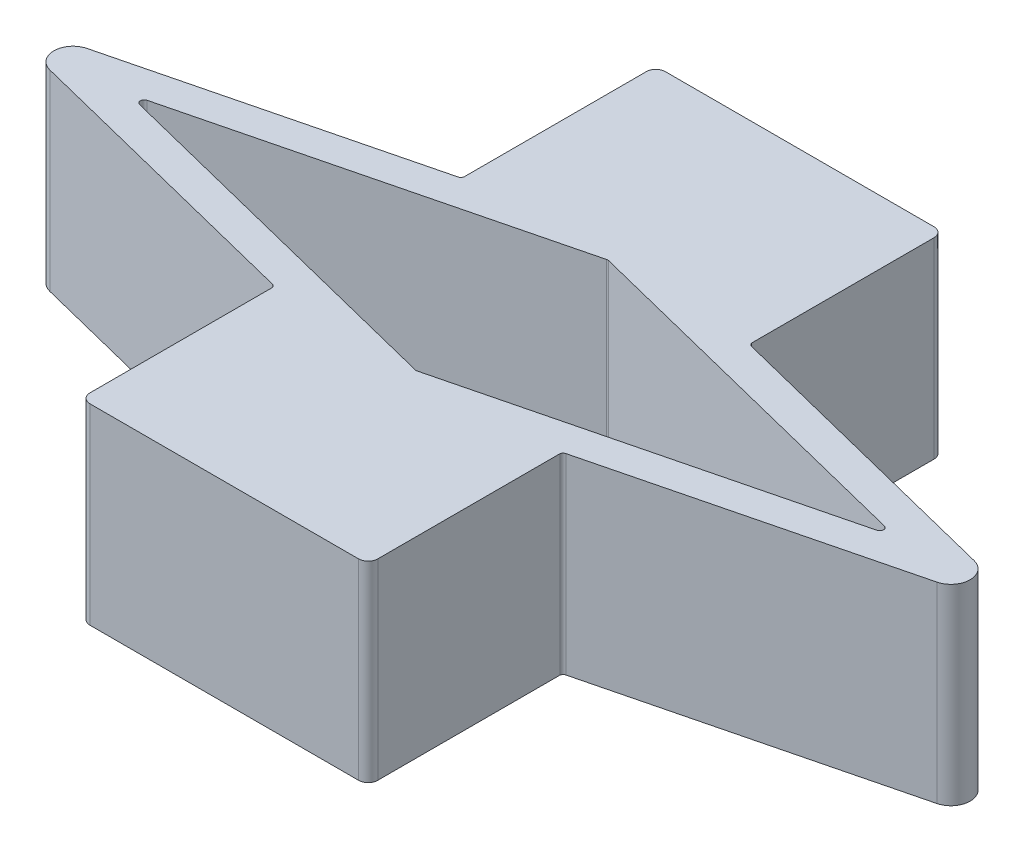
from build123d import *

# Parameters (mm, degrees)
SKETCH1_W             = 15
SKETCH1_H             = 10
BOSS_EXTRUDE2_DEPTH   = 10
BOSS_EXTRUDE2_2_DEPTH = 10
BOSS_EXTRUDE3_DEPTH   = 10
FILLET1_R             = 0.2
FILLET2_R             = 1
FILLET3_R             = 0.5


with BuildPart() as part:
    # Sketch1 → Boss-Extrude2 (new body)
    with BuildSketch(Plane(origin=(0, 0, 0), x_dir=(1, 0, 0), z_dir=(0, 1, 0))):
        with Locations((0, 20)):
            Rectangle(SKETCH1_W, SKETCH1_H)
    extrude(amount=BOSS_EXTRUDE2_DEPTH)



with BuildPart() as body_2:
    # Sketch1 → Boss-Extrude2 2 (new body)
    with BuildSketch(Plane(origin=(0, 0, 0), x_dir=(1, 0, 0), z_dir=(0, 1, 0))):
        Rectangle(SKETCH1_W, SKETCH1_H)
    extrude(amount=BOSS_EXTRUDE2_2_DEPTH)


with BuildPart() as part_1:
    add(part.part)

    add(body_2.part)  # Boss-Extrude3 merges body 2
    # Sketch1<4> → Boss-Extrude3 (add)
    with BuildSketch(Plane(origin=(0, 0, 0), x_dir=(1, 0, 0), z_dir=(0, 1, 0))):
        Polygon((-20, 10), (0, 15), (-7.009279564, 15), (-27.009279564, 10), (-7.009279564, 5), (0, 5), align=None)
    boss_extrude3 = extrude(amount=BOSS_EXTRUDE3_DEPTH)

    # Mirror1: Boss-Extrude3 across plane
    add(boss_extrude3.mirror(Plane.ZY))

    # Fillet1
    # the kernel refuses this fillet: 0.2 mm, written as the material it adds along each edge
    with BuildSketch(Plane(origin=(7.009279564, 0, -5), x_dir=(1, 0, 0), z_dir=(0, 1, 0)), Plane(origin=(-7.009279564, 0, -15), x_dir=(-1, 0, 0), z_dir=(0, 1, 0))) as fillet1_piece_1:
        with BuildLine():
            CenterArc((0.687772533, -0.034212148), FILLET1_R, 104.036243468, 66.114258118)
            Line((0.639265408, 0.159816352), (0, 0))
            Line((0, 0), (0.490720436, 0))
        make_face()
    extrude(amount=10)
    with BuildSketch(Plane(origin=(7.009279564, 0, -15), x_dir=(1, 0, 0), z_dir=(0, 1, 0)), Plane(origin=(-7.009279564, 0, -5), x_dir=(-1, 0, 0), z_dir=(0, 1, 0))) as fillet1_piece_2:
        with BuildLine():
            CenterArc((0.687772533, 0.034212148), FILLET1_R, 189.849498414, 66.114258118)
            Line((0.639265408, -0.159816352), (0, 0))
            Line((0, 0), (0.490720436, 0))
        make_face()
    extrude(amount=10)
    with BuildSketch(Plane(origin=(0, 0, -5), x_dir=(-0.9701425001453327, 0, -0.24253562503632975), z_dir=(0, 1, 0))) as fillet1_piece_3:
        with BuildLine():
            CenterArc((FILLET1_R * 0.25, -FILLET1_R), FILLET1_R, 90, 28.072486936)
            Line((-FILLET1_R * 0.220588235294, -FILLET1_R * 0.117647058824), (0, 0))
            Line((0, 0), (FILLET1_R * 0.25, 0))
        make_face()
    extrude(amount=10)
    with BuildSketch(Plane(origin=(20, 0, -10), x_dir=(-0.9701425001453313, 0, 0.24253562503633505), z_dir=(0, 1, 0))) as fillet1_piece_4:
        with BuildLine():
            CenterArc((FILLET1_R * 4, -FILLET1_R), FILLET1_R, 90, 151.927513064)
            Line((FILLET1_R * 3.52941176471, -FILLET1_R * 1.88235294118), (0, 0))
            Line((0, 0), (FILLET1_R * 4, 0))
        make_face()
    extrude(amount=10)
    with BuildSketch(Plane(origin=(0, 0, -15), x_dir=(-0.9701425001453277, 0, 0.2425356250363498), z_dir=(0, 1, 0))) as fillet1_piece_5:
        with BuildLine():
            CenterArc((FILLET1_R * 0.25, FILLET1_R), FILLET1_R, 241.927513064, 28.072486936)
            Line((-FILLET1_R * 0.220588235294, FILLET1_R * 0.117647058824), (0, 0))
            Line((0, 0), (FILLET1_R * 0.25, 0))
        make_face()
    extrude(amount=10)
    with BuildSketch(Plane(origin=(-20, 0, -10), x_dir=(0.9701425001453319, 0, 0.24253562503633297), z_dir=(0, 1, 0))) as fillet1_piece_6:
        with BuildLine():
            CenterArc((FILLET1_R * 4, FILLET1_R), FILLET1_R, 118.072486936, 151.927513064)
            Line((FILLET1_R * 3.52941176471, FILLET1_R * 1.88235294118), (0, 0))
            Line((0, 0), (FILLET1_R * 4, 0))
        make_face()
    extrude(amount=10)

    # Fillet2
    fillet2_edges = [part_1.edges().sort_by_distance(p)[0] for p in [
        (-27.009279564, 5, -10),
        (27.009279564, 5, -10),
    ]]
    fillet(fillet2_edges, radius=FILLET2_R)

    # Fillet3
    fillet3_edges = [part_1.edges().sort_by_distance(p)[0] for p in [
        (-7.5, 5, 5),
        (7.5, 5, 5),
        (-7.5, 5, -25),
        (7.5, 5, -25),
    ]]
    fillet(fillet3_edges, radius=FILLET3_R)


solid = part_1.part
